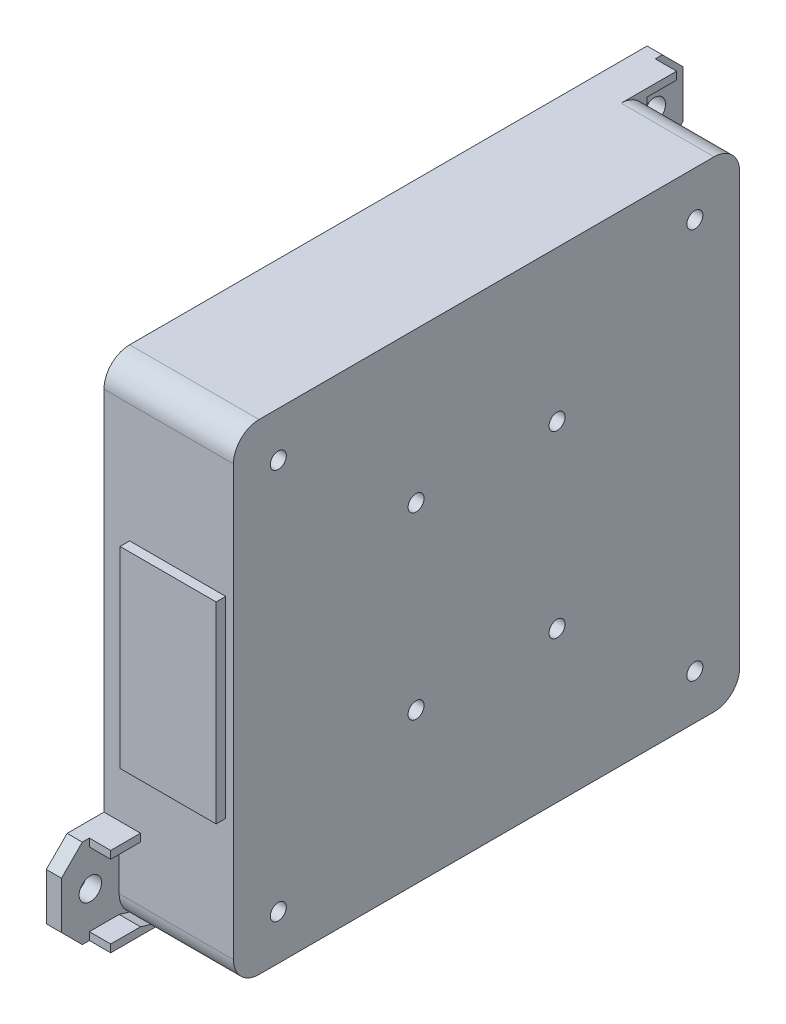
from build123d import *

# Parameters (mm, degrees)
CUT_EXTRUDE2_START       = -5.64
CUT_EXTRUDE2_DEPTH       = 15.64
CUT_EXTRUDE2_START_2     = 10
CUT_EXTRUDE2_2_OUTLINE_W = 45
CUT_EXTRUDE2_2_OUTLINE_H = 60
CUT_EXTRUDE2_2_DEPTH     = 10
CUT_EXTRUDE2_3_OUTLINE_W = 3.75
CUT_EXTRUDE2_3_OUTLINE_H = 5.38
CUT_EXTRUDE2_3_OUTLINE_R = 2.25
CUT_EXTRUDE2_3_DEPTH     = 5.64
CUT_EXTRUDE2_START_3     = 1
CUT_EXTRUDE2_4_OUTLINE_W = 1.5
CUT_EXTRUDE2_4_OUTLINE_H = 30
CUT_EXTRUDE2_4_DEPTH     = 15
CUT_EXTRUDE2_START_4     = 17.63
CUT_EXTRUDE2_5_OUTLINE_R = 1.75
CUT_EXTRUDE2_5_DEPTH     = 2.37
CUT_EXTRUDE2_6_OUTLINE_W = 3.75
CUT_EXTRUDE2_6_OUTLINE_H = 5.38
CUT_EXTRUDE2_6_DEPTH     = 2.76
SKETCH2_3_W              = 140.737770098
SKETCH2_3_H              = 110.811519169
CUT_EXTRUDE3_DEPTH       = 304.171110926
BOSS_EXTRUDE1_START      = -2.37
SKETCH3_W                = 4.65
SKETCH3_H                = 1.2
BOSS_EXTRUDE1_DEPTH      = 5.7
BOSS_EXTRUDE2_START      = 0.2
BOSS_EXTRUDE2_DEPTH      = 0.2
SKETCH5_R                = 1.25
CUT_EXTRUDE4_DEPTH       = 4


with BuildPart() as part:
    # Cut-Extrude2: read off the stored shape, not the designer's step
    # Cut-Extrude2 outline → Cut-Extrude2 (new body)
    with BuildSketch(Plane.ZY.offset(16.63).offset(CUT_EXTRUDE2_START)):
        with BuildLine():
            Line((278.35, 37.5), (207.35, 37.5))
            ThreePointArc((207.35, 37.5), (204.521572875, 36.328427125), (203.35, 33.5))
            Line((203.35, 33.5), (203.35, -33.5))
            ThreePointArc((203.35, -33.5), (204.521572875, -36.328427125), (207.35, -37.5))
            Line((207.35, -37.5), (278.35, -37.5))
            ThreePointArc((278.35, -37.5), (281.178427125, -36.328427125), (282.35, -33.5))
            Line((282.35, -33.5), (282.35, 33.5))
            ThreePointArc((282.35, 33.5), (281.178427125, 36.328427125), (278.35, 37.5))
        make_face()
    extrude(amount=CUT_EXTRUDE2_DEPTH)

    # Cut-Extrude2 2 outline → Cut-Extrude2 2 (add)
    with BuildSketch(Plane.ZY.offset(16.63).offset(CUT_EXTRUDE2_START_2)):
        with BuildLine():
            Line((278.35, 37.5), (207.35, 37.5))
            ThreePointArc((207.35, 37.5), (204.521572875, 36.328427125), (203.35, 33.5))
            Line((203.35, 33.5), (203.35, -33.5))
            ThreePointArc((203.35, -33.5), (204.521572875, -36.328427125), (207.35, -37.5))
            Line((207.35, -37.5), (278.35, -37.5))
            ThreePointArc((278.35, -37.5), (281.178427125, -36.328427125), (282.35, -33.5))
            Line((282.35, -33.5), (282.35, 33.5))
            ThreePointArc((282.35, 33.5), (281.178427125, 36.328427125), (278.35, 37.5))
        make_face()
        with Locations((242.85, 0)):
            Rectangle(CUT_EXTRUDE2_2_OUTLINE_W, CUT_EXTRUDE2_2_OUTLINE_H, mode=Mode.SUBTRACT)
    extrude(amount=CUT_EXTRUDE2_2_DEPTH)

    # Cut-Extrude2 3 outline → Cut-Extrude2 3 (add)
    with BuildSketch(Plane.ZY.offset(16.63).offset(CUT_EXTRUDE2_START)):
        with BuildLine():
            Line((265.098595461, 50), (220.601404539, 50))
            ThreePointArc((220.601404539, 50), (219.943611025, 49.92699636), (219.317831724, 49.711538462))
            ThreePointArc((219.317831724, 49.711538462), (203.959127035, 38.890872965), (193.138461538, 23.532168276))
            ThreePointArc((193.138461538, 23.532168276), (192.973645398, 23.10099455), (192.876926999, 22.649640261))
            ThreePointArc((192.876926999, 22.649640261), (192.307463231, 21.255507449), (191.132317903, 20.313738508))
            ThreePointArc((191.132317903, 20.313738508), (189.716924685, 19.276000929), (188.85, 17.75))
            Line((188.85, 17.75), (187.489252005, 13.440964681))
            ThreePointArc((187.489252005, 13.440964681), (187.385017371, 12.994602312), (187.35, 12.537570577))
            Line((187.35, 12.537570577), (187.35, -12.537570577))
            ThreePointArc((187.35, -12.537570577), (187.385017371, -12.994602312), (187.489252005, -13.440964681))
            Line((187.489252005, -13.440964681), (188.85, -17.75))
            ThreePointArc((188.85, -17.75), (189.716924685, -19.276000929), (191.132317903, -20.313738508))
            ThreePointArc((191.132317903, -20.313738508), (192.307463231, -21.255507449), (192.876926999, -22.649640261))
            ThreePointArc((192.876926999, -22.649640261), (192.973645398, -23.10099455), (193.138461538, -23.532168276))
            ThreePointArc((193.138461538, -23.532168276), (203.959127035, -38.890872965), (219.317831724, -49.711538462))
            ThreePointArc((219.317831724, -49.711538462), (219.943611025, -49.92699636), (220.601404539, -50))
            Line((220.601404539, -50), (265.098595461, -50))
            ThreePointArc((265.098595461, -50), (265.756388975, -49.92699636), (266.382168276, -49.711538462))
            ThreePointArc((266.382168276, -49.711538462), (281.740872965, -38.890872965), (292.561538462, -23.532168276))
            ThreePointArc((292.561538462, -23.532168276), (292.726354602, -23.10099455), (292.823073001, -22.649640261))
            ThreePointArc((292.823073001, -22.649640261), (293.392536769, -21.255507449), (294.567682097, -20.313738508))
            ThreePointArc((294.567682097, -20.313738508), (295.983075315, -19.276000929), (296.85, -17.75))
            Line((296.85, -17.75), (298.210747995, -13.440964681))
            ThreePointArc((298.210747995, -13.440964681), (298.314982629, -12.994602312), (298.35, -12.537570577))
            Line((298.35, -12.537570577), (298.35, 12.537570577))
            ThreePointArc((298.35, 12.537570577), (298.314982629, 12.994602312), (298.210747995, 13.440964681))
            Line((298.210747995, 13.440964681), (296.85, 17.75))
            ThreePointArc((296.85, 17.75), (295.983075315, 19.276000929), (294.567682097, 20.313738508))
            ThreePointArc((294.567682097, 20.313738508), (293.392536769, 21.255507449), (292.823073001, 22.649640261))
            ThreePointArc((292.823073001, 22.649640261), (292.726354602, 23.10099455), (292.561538462, 23.532168276))
            ThreePointArc((292.561538462, 23.532168276), (281.740872965, 38.890872965), (266.382168276, 49.711538462))
            ThreePointArc((266.382168276, 49.711538462), (265.756388975, 49.92699636), (265.098595461, 50))
        make_face()
        with BuildLine():
            ThreePointArc((282.35, -33.5), (281.178427125, -36.328427125), (278.35, -37.5))
            Line((278.35, -37.5), (207.35, -37.5))
            ThreePointArc((207.35, -37.5), (204.521572875, -36.328427125), (203.35, -33.5))
            Line((203.35, -33.5), (203.35, 33.5))
            ThreePointArc((203.35, 33.5), (204.521572875, 36.328427125), (207.35, 37.5))
            Line((207.35, 37.5), (278.35, 37.5))
            ThreePointArc((278.35, 37.5), (281.178427125, 36.328427125), (282.35, 33.5))
            Line((282.35, 33.5), (282.35, -33.5))
        make_face(mode=Mode.SUBTRACT)
        with Locations((291.85, -15.815)):
            Rectangle(CUT_EXTRUDE2_3_OUTLINE_W, CUT_EXTRUDE2_3_OUTLINE_H, mode=Mode.SUBTRACT)
        with Locations((294.35, 0)):
            Circle(CUT_EXTRUDE2_3_OUTLINE_R, mode=Mode.SUBTRACT)
        with Locations((291.85, 15.815)):
            Rectangle(CUT_EXTRUDE2_3_OUTLINE_W, CUT_EXTRUDE2_3_OUTLINE_H, mode=Mode.SUBTRACT)
        with Locations((193.85, 15.815)):
            Rectangle(CUT_EXTRUDE2_3_OUTLINE_W, CUT_EXTRUDE2_3_OUTLINE_H, mode=Mode.SUBTRACT)
        with Locations((193.85, -15.815)):
            Rectangle(CUT_EXTRUDE2_3_OUTLINE_W, CUT_EXTRUDE2_3_OUTLINE_H, mode=Mode.SUBTRACT)
        with Locations((191.35, 0)):
            Circle(CUT_EXTRUDE2_3_OUTLINE_R, mode=Mode.SUBTRACT)
    extrude(amount=CUT_EXTRUDE2_3_DEPTH)

    # Cut-Extrude2 4 outline → Cut-Extrude2 4 (add)
    with BuildSketch(Plane.ZY.offset(16.63).offset(CUT_EXTRUDE2_START_3)):
        with Locations((283.1, 0)):
            Rectangle(CUT_EXTRUDE2_4_OUTLINE_W, CUT_EXTRUDE2_4_OUTLINE_H)
    extrude(amount=CUT_EXTRUDE2_4_DEPTH)

    # Cut-Extrude2 5 outline → Cut-Extrude2 5 (add)
    # profile 1 of 2: a face of its own
    with BuildSketch(Plane.ZY.offset(16.63).offset(CUT_EXTRUDE2_START_4)):
        with BuildLine():
            Line((194.35, 26.9), (197.6, 23.65))
            Line((197.6, 23.65), (203.35, 23.65))
            Line((203.35, 23.65), (203.35, 33.5))
            ThreePointArc((203.35, 33.5), (204.521572875, 36.328427125), (207.35, 37.5))
            Line((207.35, 37.5), (197.6, 37.5))
            Line((197.6, 37.5), (194.35, 34.25))
            Line((194.35, 34.25), (194.35, 26.9))
        make_face()
        with Locations((198.85, 30.575)):
            Circle(CUT_EXTRUDE2_5_OUTLINE_R, mode=Mode.SUBTRACT)
    # profile 2 of 2: a face of its own
    with BuildSketch(Plane.ZY.offset(16.63).offset(CUT_EXTRUDE2_START_4)):
        with BuildLine():
            Line((288.1, -23.65), (282.35, -23.65))
            Line((282.35, -23.65), (282.35, -33.5))
            ThreePointArc((282.35, -33.5), (281.178427125, -36.328427125), (278.35, -37.5))
            Line((278.35, -37.5), (288.1, -37.5))
            Line((288.1, -37.5), (291.35, -34.25))
            Line((291.35, -34.25), (291.35, -26.9))
            Line((291.35, -26.9), (288.1, -23.65))
        make_face()
        with Locations((286.85, -30.575)):
            Circle(CUT_EXTRUDE2_5_OUTLINE_R, mode=Mode.SUBTRACT)
    extrude(amount=CUT_EXTRUDE2_5_DEPTH)

    # Cut-Extrude2 6 outline → Cut-Extrude2 6 (add)
    with BuildSketch(Plane.ZY.offset(16.63).offset(CUT_EXTRUDE2_START)):
        with Locations((193.85, 15.815)):
            Rectangle(CUT_EXTRUDE2_6_OUTLINE_W, CUT_EXTRUDE2_6_OUTLINE_H)
        with Locations((193.85, -15.815)):
            Rectangle(CUT_EXTRUDE2_6_OUTLINE_W, CUT_EXTRUDE2_6_OUTLINE_H)
        with Locations((291.85, 15.815)):
            Rectangle(CUT_EXTRUDE2_6_OUTLINE_W, CUT_EXTRUDE2_6_OUTLINE_H)
        with Locations((291.85, -15.815)):
            Rectangle(CUT_EXTRUDE2_6_OUTLINE_W, CUT_EXTRUDE2_6_OUTLINE_H)
    extrude(amount=CUT_EXTRUDE2_6_DEPTH)

    # Sketch2<3> → Cut-Extrude3 (cut, through all)
    with BuildSketch(Plane.ZY.offset(16.63)):
        with Locations((257.718885049, 1.798950297)):
            Rectangle(SKETCH2_3_W, SKETCH2_3_H)
    extrude(amount=-CUT_EXTRUDE3_DEPTH, mode=Mode.SUBTRACT)

    # Sketch3 → Boss-Extrude1 (add)
    with BuildSketch(Plane(origin=(-34.26, 0, 0), x_dir=(0, 0, -1), z_dir=(1, 0, 0)).offset(BOSS_EXTRUDE1_START)):
        Polygon((-207.35, 37.5), (-198.7, 37.5), (-198.7, 36.3), (-203.35, 36.3), (-203.35, 33.5), align=None)
        with Locations((-201.025, 24.25)):
            Rectangle(SKETCH3_W, SKETCH3_H)
        Polygon((-287, -37.5), (-287, -36.3), (-282.35, -36.3), (-278.35, -37.5), align=None)
        with Locations((-284.675, -24.25)):
            Rectangle(SKETCH3_W, SKETCH3_H)
    extrude(amount=BOSS_EXTRUDE1_DEPTH)

    # Sketch4 → Boss-Extrude2 (add)
    with BuildSketch(Plane(origin=(-16.63, 0, 0), x_dir=(0, 0, -1), z_dir=(1, 0, 0)).offset(BOSS_EXTRUDE2_START)):
        with BuildLine():
            Line((-278.35, 37.5), (-207.35, 37.5))
            ThreePointArc((-207.35, 37.5), (-204.521572875, 36.328427125), (-203.35, 33.5))
            Line((-203.35, 33.5), (-203.35, -33.5))
            ThreePointArc((-203.35, -33.5), (-204.521572875, -36.328427125), (-207.35, -37.5))
            Line((-207.35, -37.5), (-278.35, -37.5))
            ThreePointArc((-278.35, -37.5), (-281.178427125, -36.328427125), (-282.35, -33.5))
            Line((-282.35, -33.5), (-282.35, 33.5))
            ThreePointArc((-282.35, 33.5), (-281.178427125, 36.328427125), (-278.35, 37.5))
        make_face()
    extrude(amount=-BOSS_EXTRUDE2_DEPTH)

    # Sketch5 → Cut-Extrude4 (cut)
    with BuildSketch(Plane(origin=(-16.43, 0, 0), x_dir=(0, 0, -1), z_dir=(1, 0, 0))):
        with Locations((-275.35, 30.5)):
            Circle(SKETCH5_R)
        with Locations((-210.35, 30.5)):
            Circle(SKETCH5_R)
        with Locations((-210.35, -30.5)):
            Circle(SKETCH5_R)
        with Locations((-275.35, -30.5)):
            Circle(SKETCH5_R)
        with Locations((-253.85, 14)):
            Circle(SKETCH5_R)
        with Locations((-231.85, 14)):
            Circle(SKETCH5_R)
        with Locations((-231.85, -14)):
            Circle(SKETCH5_R)
        with Locations((-253.85, -14)):
            Circle(SKETCH5_R)
    extrude(amount=-CUT_EXTRUDE4_DEPTH, mode=Mode.SUBTRACT)


solid = part.part
